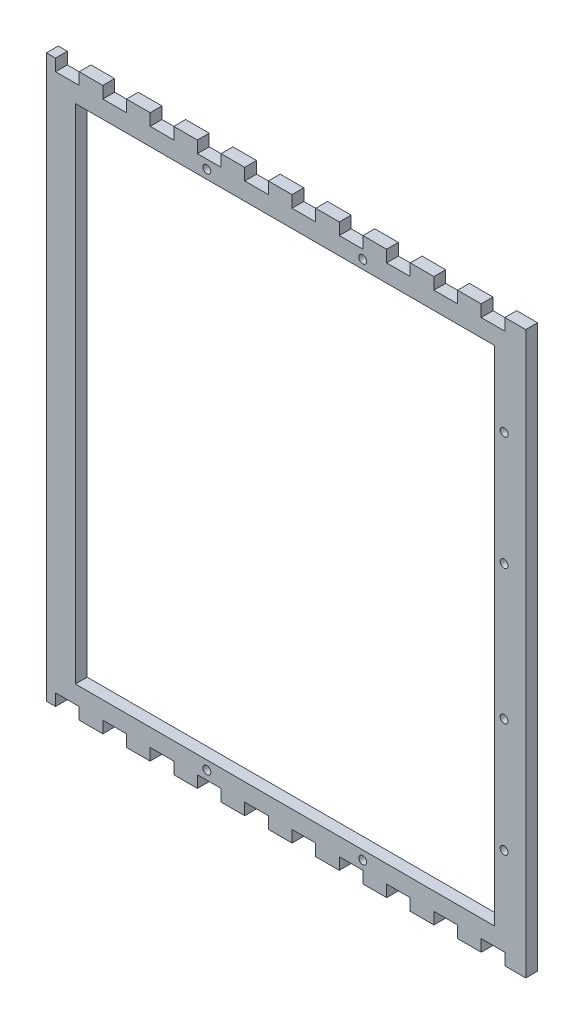
from build123d import *

# Parameters (mm, degrees)
BOSS_EXTRUDE1_DEPTH                               = 5.715
SKETCH1_W                                         = 202.5
SKETCH1_H                                         = 243
CUT_EXTRUDE1_DEPTH                                = 1411.943482069
CSK_FOR_6_FLAT_HEAD_MACHINE_SCREW_100_D           = 3.7973
CSK_FOR_6_FLAT_HEAD_MACHINE_SCREW_100_CSINK_D     = 7.0866
CSK_FOR_6_FLAT_HEAD_MACHINE_SCREW_100_CSINK_ANGLE = 100
CSK_FOR_6_FLAT_HEAD_MACHINE_SCREW_2_D             = 3.7973
CSK_FOR_6_FLAT_HEAD_MACHINE_SCREW_2_CSINK_D       = 7.0866
CSK_FOR_6_FLAT_HEAD_MACHINE_SCREW_2_CSINK_ANGLE   = 100


with BuildPart() as part:
    # Model → Boss-Extrude1 (new body)
    with BuildSketch(Plane.XY):
        Polygon((1148.22, 22.8575), (1152.62, 22.8575), (1152.62, 28.5722), (1164.05, 28.5722), (1164.05, 22.8575), (1175.48, 22.8575), (1175.48, 28.5722), (1186.91, 28.5722), (1186.91, 22.8575), (1198.34, 22.8575), (1198.34, 28.5722), (1209.77, 28.5722), (1209.77, 22.8575), (1221.2, 22.8575), (1221.2, 28.5722), (1232.63, 28.5722), (1232.63, 22.8575), (1244.06, 22.8575), (1244.06, 28.5722), (1255.49, 28.5722), (1255.49, 22.8575), (1266.92, 22.8575), (1266.92, 28.5722), (1278.35, 28.5722), (1278.35, 22.8575), (1289.78, 22.8575), (1289.78, 28.5722), (1301.21, 28.5722), (1301.21, 22.8575), (1312.64, 22.8575), (1312.64, 28.5722), (1324.07, 28.5722), (1324.07, 22.8575), (1335.5, 22.8575), (1335.5, 28.5722), (1346.93, 28.5722), (1346.93, 22.8575), (1358.36, 22.8575), (1358.36, 28.5722), (1369.79, 28.5722), (1369.79, 22.8575), (1374.18, 22.8575), (1379.9, 22.8575), (1379.9, 28.5722), (1379.9, 288.572), (1379.9, 294.287), (1374.18, 294.287), (1369.79, 294.287), (1369.79, 288.572), (1358.36, 288.572), (1358.36, 294.287), (1346.93, 294.287), (1346.93, 288.572), (1335.5, 288.572), (1335.5, 294.287), (1324.07, 294.287), (1324.07, 288.572), (1312.64, 288.572), (1312.64, 294.287), (1301.21, 294.287), (1301.21, 288.572), (1289.78, 288.572), (1289.78, 294.287), (1278.35, 294.287), (1278.35, 288.572), (1266.92, 288.572), (1266.92, 294.287), (1255.49, 294.287), (1255.49, 288.572), (1244.06, 288.572), (1244.06, 294.287), (1232.63, 294.287), (1232.63, 288.572), (1221.2, 288.572), (1221.2, 294.287), (1209.77, 294.287), (1209.77, 288.572), (1198.34, 288.572), (1198.34, 294.287), (1186.91, 294.287), (1186.91, 288.572), (1175.48, 288.572), (1175.48, 294.287), (1164.05, 294.287), (1164.05, 288.572), (1152.62, 288.572), (1152.62, 294.287), (1148.22, 294.287), (1148.22, 288.572), (1148.22, 28.5722), align=None)
    extrude(amount=BOSS_EXTRUDE1_DEPTH)

    # Sketch1 → Cut-Extrude1 (cut, through all)
    with BuildSketch(Plane(origin=(0, 0, 0), x_dir=(-1, 0, 0), z_dir=(0, 0, -1))):
        with Locations((-1263.435, 158.57195)):
            Rectangle(SKETCH1_W, SKETCH1_H)
    extrude(amount=-CUT_EXTRUDE1_DEPTH, mode=Mode.SUBTRACT)

    # CSK for _6 Flat Head Machine Screw _100 (through all)
    with Locations(Plane(origin=(0, 0, 0), x_dir=(-1, 0, 0), z_dir=(0, 0, -1))):
        with Locations((-1301.10166666, 284.321975), (-1225.76833334, 284.321975), (-1225.76833334, 32.822525), (-1301.10166666, 32.822525)):
            CounterSinkHole(CSK_FOR_6_FLAT_HEAD_MACHINE_SCREW_100_D / 2, CSK_FOR_6_FLAT_HEAD_MACHINE_SCREW_100_CSINK_D / 2, counter_sink_angle=CSK_FOR_6_FLAT_HEAD_MACHINE_SCREW_100_CSINK_ANGLE)

    # CSK for _6 Flat Head Machine Screw _ 2 (through all)
    with Locations(Plane(origin=(0, 0, 0), x_dir=(-1, 0, 0), z_dir=(0, 0, -1))):
        with Locations((-1369.435, 246.0721), (-1369.435, 191.0721), (-1369.435, 126.0721), (-1369.435, 71.0721)):
            CounterSinkHole(CSK_FOR_6_FLAT_HEAD_MACHINE_SCREW_2_D / 2, CSK_FOR_6_FLAT_HEAD_MACHINE_SCREW_2_CSINK_D / 2, counter_sink_angle=CSK_FOR_6_FLAT_HEAD_MACHINE_SCREW_2_CSINK_ANGLE)


solid = part.part
